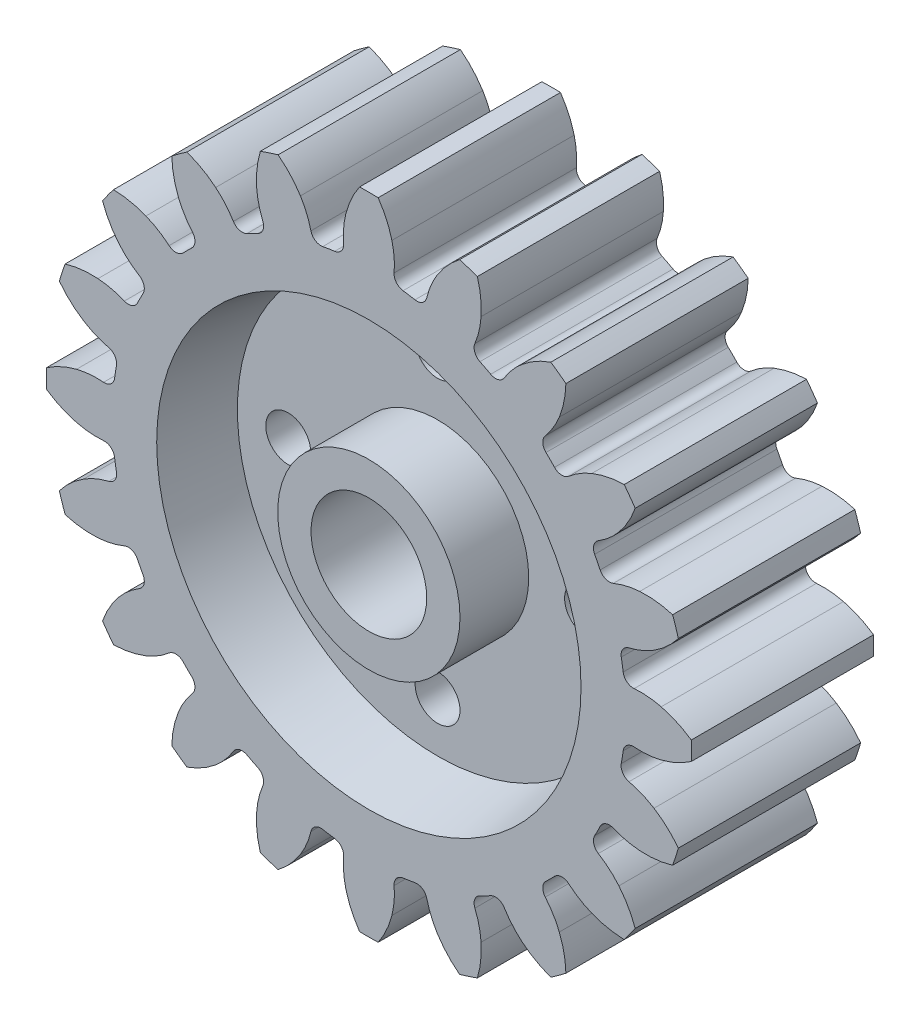
from build123d import *

# Parameters (mm, degrees)
SKETCH1_R                = 10.793750066
BLANK_DISK_DEPTH         = 3.05
GEAR_TOOTH_CUT_DEPTH     = 17.43837221
GEAR_START               = -3.049999996
GEAR_TEETH_REVOLVE_DEPTH = 6.099999992
SKETCH3_R                = 1.93499994
SKETCH3_R_2              = 0.7499985
HUB_EXTRUDE_DEPTH        = 17.43837221
SKETCH4_R                = 6.700000062
FRONT_HOLLOW_DEPTH       = 2.299999972
BACK_START               = -2.299999972
SKETCH5_R                = 6.700000062
BACK_HOLLOW_DEPTH        = 2.299999972
SKETCH6_R                = 7.100000024
SKETCH9_R                = 3.049999996
SKETCH9_R_2              = 1.93499994
BACK_HUB_DEPTH           = 2.299999972
SKETCH7_R                = 7.100000024
FRONT_START              = 2.299999972
SKETCH10_R               = 3.049999996
SKETCH10_R_2             = 1.93499994
FRONT_HUB_DEPTH          = 2.299999972


# Read off the part's stored shape, not the designer's step: GEAR TEETH REVOLVE
with BuildPart() as part:
    # Sketch1 → BLANK DISK (new, symmetric)
    with BuildSketch(Plane.XY):
        with Locations(Location((0, 0, 0), (0, 0, 180))):
            Circle(SKETCH1_R)
    extrude(amount=BLANK_DISK_DEPTH, both=True)

    # Sketch2 → GEAR TOOTH CUT (cut, through all)
    with BuildSketch(Plane.XY.offset(3.049999996)):
        with BuildLine():
            ThreePointArc((-10.35757296, -3.037387507), (-10.660861091, -1.688514517), (-10.789241615, -0.311938884))
            ThreePointArc((-10.789241615, -0.311938884), (-10.306466905, -0.586910221), (-9.782181154, -0.77077188))
            ThreePointArc((-9.782181154, -0.77077188), (-9.332976184, -0.845637373), (-8.877575708, -0.84623176))
            ThreePointArc((-8.877575708, -0.84623176), (-8.634412219, -0.921148144), (-8.509538159, -1.142840309))
            ThreePointArc((-8.509538159, -1.142840309), (-8.480230414, -1.343136548), (-8.446208794, -1.542686182))
            ThreePointArc((-8.446208794, -1.542686182), (-8.496464436, -1.792116167), (-8.704576221, -1.938507533))
            ThreePointArc((-8.704576221, -1.938507533), (-9.137504136, -2.079799315), (-9.54158874, -2.2898126))
            ThreePointArc((-9.54158874, -2.2898126), (-9.983397742, -2.626688635), (-10.35757296, -3.037387507))
        make_face()
    extrude(amount=-GEAR_TOOTH_CUT_DEPTH, mode=Mode.SUBTRACT)

    # GEAR TEETH REVOLVE outline → GEAR TEETH REVOLVE (cut)
    with BuildSketch(Plane.XY.offset(GEAR_START)):
        with BuildLine():
            ThreePointArc((-10.164784127, -3.630730523), (-9.617301729, -4.900259986), (-8.912032898, -6.089393246))
            ThreePointArc((-8.912032898, -6.089393246), (-8.68308405, -5.583168907), (-8.36699914, -5.126254268))
            ThreePointArc((-8.36699914, -5.126254268), (-8.047589518, -4.801650755), (-7.679512165, -4.533492202))
            ThreePointArc((-7.679512165, -4.533492202), (-7.526823516, -4.329955662), (-7.556105665, -4.077203802))
            ThreePointArc((-7.556105665, -4.077203802), (-7.650126376, -3.897934081), (-7.739894639, -3.716497629))
            ThreePointArc((-7.739894639, -3.716497629), (-7.927163574, -3.544244057), (-8.181576231, -3.548135993))
            ThreePointArc((-8.181576231, -3.548135993), (-8.614871497, -3.688297183), (-9.065225521, -3.755907838))
            ThreePointArc((-9.065225521, -3.755907838), (-9.620667277, -3.743058216), (-10.164784127, -3.630730523))
        make_face()
        with BuildLine():
            ThreePointArc((-8.545326747, -6.594120963), (-7.632333866, -7.632333866), (-6.594120963, -8.545326747))
            ThreePointArc((-6.594120963, -8.545326747), (-6.532809593, -7.993129705), (-6.373389367, -7.460902452))
            ThreePointArc((-6.373389367, -7.460902452), (-6.169920767, -7.053483165), (-5.902723953, -6.684707068))
            ThreePointArc((-5.902723953, -6.684707068), (-5.820404668, -6.443948927), (-5.926358266, -6.212616305))
            ThreePointArc((-5.926358266, -6.212616305), (-6.071174666, -6.071174666), (-6.212616305, -5.926358266))
            ThreePointArc((-6.212616305, -5.926358266), (-6.443948927, -5.820404668), (-6.684707068, -5.902723953))
            ThreePointArc((-6.684707068, -5.902723953), (-7.053483165, -6.169920767), (-7.460902452, -6.373389367))
            ThreePointArc((-7.460902452, -6.373389367), (-7.993129705, -6.532809593), (-8.545326747, -6.594120963))
        make_face()
        with BuildLine():
            ThreePointArc((-6.089393246, -8.912032898), (-4.900259986, -9.617301729), (-3.630730523, -10.164784127))
            ThreePointArc((-3.630730523, -10.164784127), (-3.743058216, -9.620667277), (-3.755907838, -9.065225521))
            ThreePointArc((-3.755907838, -9.065225521), (-3.688297183, -8.614871497), (-3.548135993, -8.181576231))
            ThreePointArc((-3.548135993, -8.181576231), (-3.544244057, -7.927163574), (-3.716497629, -7.739894639))
            ThreePointArc((-3.716497629, -7.739894639), (-3.897934081, -7.650126376), (-4.077203802, -7.556105665))
            ThreePointArc((-4.077203802, -7.556105665), (-4.329955662, -7.526823516), (-4.533492202, -7.679512165))
            ThreePointArc((-4.533492202, -7.679512165), (-4.801650755, -8.047589518), (-5.126254268, -8.36699914))
            ThreePointArc((-5.126254268, -8.36699914), (-5.583168907, -8.68308405), (-6.089393246, -8.912032898))
        make_face()
        with BuildLine():
            ThreePointArc((-3.037387507, -10.357572959), (-1.688514517, -10.660861091), (-0.311938884, -10.789241614))
            ThreePointArc((-0.311938884, -10.789241614), (-0.586910221, -10.306466904), (-0.77077188, -9.782181154))
            ThreePointArc((-0.77077188, -9.782181154), (-0.845637373, -9.332976184), (-0.84623176, -8.877575708))
            ThreePointArc((-0.84623176, -8.877575708), (-0.921148144, -8.634412219), (-1.142840309, -8.509538159))
            ThreePointArc((-1.142840309, -8.509538159), (-1.343136548, -8.480230414), (-1.542686182, -8.446208794))
            ThreePointArc((-1.542686182, -8.446208794), (-1.792116167, -8.496464436), (-1.938507533, -8.704576221))
            ThreePointArc((-1.938507533, -8.704576221), (-2.079799315, -9.137504136), (-2.2898126, -9.54158874))
            ThreePointArc((-2.2898126, -9.54158874), (-2.626688635, -9.983397742), (-3.037387507, -10.357572959))
        make_face()
        with BuildLine():
            ThreePointArc((0.311938884, -10.789241614), (1.688514517, -10.66086109), (3.037387507, -10.357572959))
            ThreePointArc((3.037387507, -10.357572959), (2.626688635, -9.983397742), (2.2898126, -9.54158874))
            ThreePointArc((2.2898126, -9.54158874), (2.079799315, -9.137504136), (1.938507533, -8.704576221))
            ThreePointArc((1.938507533, -8.704576221), (1.792116167, -8.496464436), (1.542686182, -8.446208794))
            ThreePointArc((1.542686182, -8.446208794), (1.343136548, -8.480230414), (1.142840309, -8.509538159))
            ThreePointArc((1.142840309, -8.509538159), (0.921148144, -8.634412219), (0.84623176, -8.877575708))
            ThreePointArc((0.84623176, -8.877575708), (0.845637373, -9.332976184), (0.77077188, -9.782181154))
            ThreePointArc((0.77077188, -9.782181154), (0.586910221, -10.306466904), (0.311938884, -10.789241614))
        make_face()
        with BuildLine():
            ThreePointArc((3.630730523, -10.164784126), (4.900259986, -9.617301728), (6.089393246, -8.912032897))
            ThreePointArc((6.089393246, -8.912032897), (5.583168907, -8.68308405), (5.126254268, -8.36699914))
            ThreePointArc((5.126254268, -8.36699914), (4.801650755, -8.047589518), (4.533492202, -7.679512165))
            ThreePointArc((4.533492202, -7.679512165), (4.329955662, -7.526823516), (4.077203802, -7.556105665))
            ThreePointArc((4.077203802, -7.556105665), (3.897934081, -7.650126376), (3.716497629, -7.739894639))
            ThreePointArc((3.716497629, -7.739894639), (3.544244057, -7.927163574), (3.548135993, -8.181576231))
            ThreePointArc((3.548135993, -8.181576231), (3.688297183, -8.614871497), (3.755907838, -9.065225521))
            ThreePointArc((3.755907838, -9.065225521), (3.743058216, -9.620667277), (3.630730523, -10.164784126))
        make_face()
        with BuildLine():
            ThreePointArc((6.594120962, -8.545326746), (7.632333865, -7.632333865), (8.545326746, -6.594120962))
            ThreePointArc((8.545326746, -6.594120962), (7.993129705, -6.532809593), (7.460902452, -6.373389367))
            ThreePointArc((7.460902452, -6.373389367), (7.053483165, -6.169920767), (6.684707068, -5.902723953))
            ThreePointArc((6.684707068, -5.902723953), (6.443948927, -5.820404668), (6.212616305, -5.926358266))
            ThreePointArc((6.212616305, -5.926358266), (6.071174666, -6.071174666), (5.926358266, -6.212616305))
            ThreePointArc((5.926358266, -6.212616305), (5.820404668, -6.443948927), (5.902723953, -6.684707068))
            ThreePointArc((5.902723953, -6.684707068), (6.169920767, -7.053483165), (6.373389367, -7.460902452))
            ThreePointArc((6.373389367, -7.460902452), (6.532809593, -7.993129705), (6.594120962, -8.545326746))
        make_face()
        with BuildLine():
            ThreePointArc((8.912032897, -6.089393246), (9.617301729, -4.900259986), (10.164784127, -3.630730523))
            ThreePointArc((10.164784127, -3.630730523), (9.620667277, -3.743058216), (9.065225521, -3.755907838))
            ThreePointArc((9.065225521, -3.755907838), (8.614871497, -3.688297183), (8.181576231, -3.548135993))
            ThreePointArc((8.181576231, -3.548135993), (7.927163574, -3.544244057), (7.739894639, -3.716497629))
            ThreePointArc((7.739894639, -3.716497629), (7.650126376, -3.897934081), (7.556105665, -4.077203802))
            ThreePointArc((7.556105665, -4.077203802), (7.526823516, -4.329955662), (7.679512165, -4.533492202))
            ThreePointArc((7.679512165, -4.533492202), (8.047589518, -4.801650755), (8.36699914, -5.126254268))
            ThreePointArc((8.36699914, -5.126254268), (8.68308405, -5.583168907), (8.912032897, -6.089393246))
        make_face()
        with BuildLine():
            ThreePointArc((10.357572959, -3.037387507), (10.660861091, -1.688514517), (10.789241614, -0.311938884))
            ThreePointArc((10.789241614, -0.311938884), (10.306466904, -0.586910221), (9.782181154, -0.77077188))
            ThreePointArc((9.782181154, -0.77077188), (9.332976184, -0.845637373), (8.877575708, -0.84623176))
            ThreePointArc((8.877575708, -0.84623176), (8.634412219, -0.921148144), (8.509538159, -1.142840309))
            ThreePointArc((8.509538159, -1.142840309), (8.480230414, -1.343136548), (8.446208794, -1.542686182))
            ThreePointArc((8.446208794, -1.542686182), (8.496464436, -1.792116167), (8.704576221, -1.938507533))
            ThreePointArc((8.704576221, -1.938507533), (9.137504136, -2.079799315), (9.54158874, -2.2898126))
            ThreePointArc((9.54158874, -2.2898126), (9.983397742, -2.626688635), (10.357572959, -3.037387507))
        make_face()
        with BuildLine():
            ThreePointArc((10.789241614, 0.311938884), (10.660861091, 1.688514517), (10.35757296, 3.037387507))
            ThreePointArc((10.35757296, 3.037387507), (9.983397742, 2.626688635), (9.54158874, 2.2898126))
            ThreePointArc((9.54158874, 2.2898126), (9.137504136, 2.079799315), (8.704576221, 1.938507533))
            ThreePointArc((8.704576221, 1.938507533), (8.496464436, 1.792116167), (8.446208794, 1.542686182))
            ThreePointArc((8.446208794, 1.542686182), (8.480230414, 1.343136548), (8.509538159, 1.142840309))
            ThreePointArc((8.509538159, 1.142840309), (8.634412219, 0.921148144), (8.877575708, 0.84623176))
            ThreePointArc((8.877575708, 0.84623176), (9.332976184, 0.845637373), (9.782181154, 0.77077188))
            ThreePointArc((9.782181154, 0.77077188), (10.306466904, 0.586910221), (10.789241614, 0.311938884))
        make_face()
        with BuildLine():
            ThreePointArc((10.164784127, 3.630730523), (9.617301729, 4.900259986), (8.912032898, 6.089393246))
            ThreePointArc((8.912032898, 6.089393246), (8.68308405, 5.583168907), (8.36699914, 5.126254268))
            ThreePointArc((8.36699914, 5.126254268), (8.047589518, 4.801650755), (7.679512165, 4.533492202))
            ThreePointArc((7.679512165, 4.533492202), (7.526823516, 4.329955662), (7.556105665, 4.077203802))
            ThreePointArc((7.556105665, 4.077203802), (7.650126376, 3.897934081), (7.739894639, 3.716497629))
            ThreePointArc((7.739894639, 3.716497629), (7.927163574, 3.544244057), (8.181576231, 3.548135993))
            ThreePointArc((8.181576231, 3.548135993), (8.614871497, 3.688297183), (9.065225521, 3.755907838))
            ThreePointArc((9.065225521, 3.755907838), (9.620667277, 3.743058216), (10.164784127, 3.630730523))
        make_face()
        with BuildLine():
            ThreePointArc((8.545326747, 6.594120963), (7.632333866, 7.632333866), (6.594120963, 8.545326747))
            ThreePointArc((6.594120963, 8.545326747), (6.532809593, 7.993129705), (6.373389367, 7.460902452))
            ThreePointArc((6.373389367, 7.460902452), (6.169920767, 7.053483165), (5.902723953, 6.684707068))
            ThreePointArc((5.902723953, 6.684707068), (5.820404668, 6.443948927), (5.926358266, 6.212616305))
            ThreePointArc((5.926358266, 6.212616305), (6.071174666, 6.071174666), (6.212616305, 5.926358266))
            ThreePointArc((6.212616305, 5.926358266), (6.443948927, 5.820404668), (6.684707068, 5.902723953))
            ThreePointArc((6.684707068, 5.902723953), (7.053483165, 6.169920767), (7.460902452, 6.373389367))
            ThreePointArc((7.460902452, 6.373389367), (7.993129705, 6.532809593), (8.545326747, 6.594120963))
        make_face()
        with BuildLine():
            ThreePointArc((6.089393246, 8.912032898), (4.900259986, 9.61730173), (3.630730523, 10.164784128))
            ThreePointArc((3.630730523, 10.164784128), (3.743058216, 9.620667277), (3.755907838, 9.065225521))
            ThreePointArc((3.755907838, 9.065225521), (3.688297183, 8.614871497), (3.548135993, 8.181576231))
            ThreePointArc((3.548135993, 8.181576231), (3.544244057, 7.927163574), (3.716497629, 7.739894639))
            ThreePointArc((3.716497629, 7.739894639), (3.897934081, 7.650126376), (4.077203802, 7.556105665))
            ThreePointArc((4.077203802, 7.556105665), (4.329955662, 7.526823516), (4.533492202, 7.679512165))
            ThreePointArc((4.533492202, 7.679512165), (4.801650755, 8.047589518), (5.126254268, 8.36699914))
            ThreePointArc((5.126254268, 8.36699914), (5.583168907, 8.68308405), (6.089393246, 8.912032898))
        make_face()
        with BuildLine():
            ThreePointArc((3.037387507, 10.35757296), (1.688514517, 10.660861092), (0.311938884, 10.789241615))
            ThreePointArc((0.311938884, 10.789241615), (0.586910221, 10.306466904), (0.77077188, 9.782181154))
            ThreePointArc((0.77077188, 9.782181154), (0.845637373, 9.332976184), (0.84623176, 8.877575708))
            ThreePointArc((0.84623176, 8.877575708), (0.921148144, 8.634412219), (1.142840309, 8.509538159))
            ThreePointArc((1.142840309, 8.509538159), (1.343136548, 8.480230414), (1.542686182, 8.446208794))
            ThreePointArc((1.542686182, 8.446208794), (1.792116167, 8.496464436), (1.938507533, 8.704576221))
            ThreePointArc((1.938507533, 8.704576221), (2.079799315, 9.137504136), (2.2898126, 9.54158874))
            ThreePointArc((2.2898126, 9.54158874), (2.626688635, 9.983397742), (3.037387507, 10.35757296))
        make_face()
        with BuildLine():
            ThreePointArc((-0.311938884, 10.789241615), (-1.688514517, 10.660861092), (-3.037387507, 10.357572961))
            ThreePointArc((-3.037387507, 10.357572961), (-2.626688635, 9.983397742), (-2.2898126, 9.54158874))
            ThreePointArc((-2.2898126, 9.54158874), (-2.079799315, 9.137504136), (-1.938507533, 8.704576221))
            ThreePointArc((-1.938507533, 8.704576221), (-1.792116167, 8.496464436), (-1.542686182, 8.446208794))
            ThreePointArc((-1.542686182, 8.446208794), (-1.343136548, 8.480230414), (-1.142840309, 8.509538159))
            ThreePointArc((-1.142840309, 8.509538159), (-0.921148144, 8.634412219), (-0.84623176, 8.877575708))
            ThreePointArc((-0.84623176, 8.877575708), (-0.845637373, 9.332976184), (-0.77077188, 9.782181154))
            ThreePointArc((-0.77077188, 9.782181154), (-0.586910221, 10.306466904), (-0.311938884, 10.789241615))
        make_face()
        with BuildLine():
            ThreePointArc((-3.630730523, 10.164784128), (-4.900259987, 9.61730173), (-6.089393247, 8.912032899))
            ThreePointArc((-6.089393247, 8.912032899), (-5.583168907, 8.68308405), (-5.126254268, 8.36699914))
            ThreePointArc((-5.126254268, 8.36699914), (-4.801650755, 8.047589518), (-4.533492202, 7.679512165))
            ThreePointArc((-4.533492202, 7.679512165), (-4.329955662, 7.526823516), (-4.077203802, 7.556105665))
            ThreePointArc((-4.077203802, 7.556105665), (-3.897934081, 7.650126376), (-3.716497629, 7.739894639))
            ThreePointArc((-3.716497629, 7.739894639), (-3.544244057, 7.927163574), (-3.548135993, 8.181576231))
            ThreePointArc((-3.548135993, 8.181576231), (-3.688297183, 8.614871497), (-3.755907838, 9.065225521))
            ThreePointArc((-3.755907838, 9.065225521), (-3.743058216, 9.620667277), (-3.630730523, 10.164784128))
        make_face()
        with BuildLine():
            ThreePointArc((-6.594120963, 8.545326748), (-7.632333867, 7.632333867), (-8.545326748, 6.594120963))
            ThreePointArc((-8.545326748, 6.594120963), (-7.993129705, 6.532809593), (-7.460902452, 6.373389367))
            ThreePointArc((-7.460902452, 6.373389367), (-7.053483165, 6.169920767), (-6.684707068, 5.902723953))
            ThreePointArc((-6.684707068, 5.902723953), (-6.443948927, 5.820404668), (-6.212616305, 5.926358266))
            ThreePointArc((-6.212616305, 5.926358266), (-6.071174666, 6.071174666), (-5.926358266, 6.212616305))
            ThreePointArc((-5.926358266, 6.212616305), (-5.820404668, 6.443948927), (-5.902723953, 6.684707068))
            ThreePointArc((-5.902723953, 6.684707068), (-6.169920767, 7.053483165), (-6.373389367, 7.460902452))
            ThreePointArc((-6.373389367, 7.460902452), (-6.532809593, 7.993129705), (-6.594120963, 8.545326748))
        make_face()
        with BuildLine():
            ThreePointArc((-8.912032899, 6.089393247), (-9.61730173, 4.900259987), (-10.164784128, 3.630730523))
            ThreePointArc((-10.164784128, 3.630730523), (-9.620667277, 3.743058216), (-9.065225521, 3.755907838))
            ThreePointArc((-9.065225521, 3.755907838), (-8.614871497, 3.688297183), (-8.181576231, 3.548135993))
            ThreePointArc((-8.181576231, 3.548135993), (-7.927163574, 3.544244057), (-7.739894639, 3.716497629))
            ThreePointArc((-7.739894639, 3.716497629), (-7.650126376, 3.897934081), (-7.556105665, 4.077203802))
            ThreePointArc((-7.556105665, 4.077203802), (-7.526823516, 4.329955662), (-7.679512165, 4.533492202))
            ThreePointArc((-7.679512165, 4.533492202), (-8.047589518, 4.801650755), (-8.36699914, 5.126254268))
            ThreePointArc((-8.36699914, 5.126254268), (-8.68308405, 5.583168907), (-8.912032899, 6.089393247))
        make_face()
        with BuildLine():
            ThreePointArc((-8.509538159, 1.142840309), (-8.480230414, 1.343136548), (-8.446208794, 1.542686182))
            ThreePointArc((-8.446208794, 1.542686182), (-8.496464436, 1.792116167), (-8.704576221, 1.938507533))
            ThreePointArc((-8.704576221, 1.938507533), (-9.137504136, 2.079799315), (-9.54158874, 2.2898126))
            ThreePointArc((-9.54158874, 2.2898126), (-9.983397742, 2.626688635), (-10.35757296, 3.037387507))
            ThreePointArc((-10.35757296, 3.037387507), (-10.660861092, 1.688514517), (-10.789241615, 0.311938884))
            ThreePointArc((-10.789241615, 0.311938884), (-10.306466904, 0.586910221), (-9.782181154, 0.77077188))
            ThreePointArc((-9.782181154, 0.77077188), (-9.332976184, 0.845637373), (-8.877575708, 0.84623176))
            ThreePointArc((-8.877575708, 0.84623176), (-8.634412219, 0.921148144), (-8.509538159, 1.142840309))
        make_face()
    extrude(amount=GEAR_TEETH_REVOLVE_DEPTH, mode=Mode.SUBTRACT)

    # Sketch3 → HUB EXTRUDE (cut, through all)
    with BuildSketch(Plane.XY.offset(3.049999996)):
        Circle(SKETCH3_R)
        with Locations((0, 4.99999)):
            Circle(SKETCH3_R_2)
        with Locations((4.99999, 0)):
            Circle(SKETCH3_R_2)
        with Locations((0, -4.99999)):
            Circle(SKETCH3_R_2)
        with Locations((-4.99999, 0)):
            Circle(SKETCH3_R_2)
    extrude(amount=-HUB_EXTRUDE_DEPTH, mode=Mode.SUBTRACT)

    # Sketch4 → FRONT HOLLOW (cut)
    with BuildSketch(Plane.XY.offset(3.049999996)):
        Circle(SKETCH4_R)
    extrude(amount=-FRONT_HOLLOW_DEPTH, mode=Mode.SUBTRACT)

    # Sketch5 → BACK HOLLOW (cut)
    with BuildSketch(Plane(origin=(0, 0, -3.049999996), x_dir=(-1, 0, 0), z_dir=(0, 0, -1)).offset(BACK_START)):
        with Locations(Location((0, 0, 0), (0, 0, 180))):
            Circle(SKETCH5_R)
    extrude(amount=BACK_HOLLOW_DEPTH, mode=Mode.SUBTRACT)

    # Sketch6 → section 0 of back_loft
    with BuildSketch(Plane(origin=(0, 0, -3.049999996), x_dir=(-1, 0, 0), z_dir=(0, 0, -1)), mode=Mode.PRIVATE) as back_loft_s0:
        Circle(SKETCH6_R)
    # loft up to a face of the part (back_loft)
    loft([back_loft_s0.sketch, Face(Wire([part.edges().sort_by_distance((-4.586465652, -4.884089849, -0.750000024))[0]]))], mode=Mode.SUBTRACT)

    # Sketch9 → BACK HUB (add)
    with BuildSketch(Plane(origin=(0, 0, -0.750000024), x_dir=(-1, 0, 0), z_dir=(0, 0, -1))):
        with Locations(Location((0, 0, 0), (0, 0, 180))):
            Circle(SKETCH9_R)
        with Locations(Location((0, 0, 0), (0, 0, 180))):
            Circle(SKETCH9_R_2, mode=Mode.SUBTRACT)
    extrude(amount=BACK_HUB_DEPTH)

    # Sketch7 → section 0 of front_loft
    with BuildSketch(Plane.XY.offset(3.049999996), mode=Mode.PRIVATE) as front_loft_s0:
        Circle(SKETCH7_R)
    # loft up to a face of the part (front_loft)
    loft([front_loft_s0.sketch, Face(Wire([part.edges().sort_by_distance((-4.586465652, 4.884089849, 0.750000024))[0]]))], mode=Mode.SUBTRACT)

    # Sketch10 → FRONT HUB (add)
    with BuildSketch(Plane.XY.offset(0.750000024).offset(FRONT_START)):
        Circle(SKETCH10_R)
        Circle(SKETCH10_R_2, mode=Mode.SUBTRACT)
    extrude(amount=-FRONT_HUB_DEPTH)


solid = part.part
